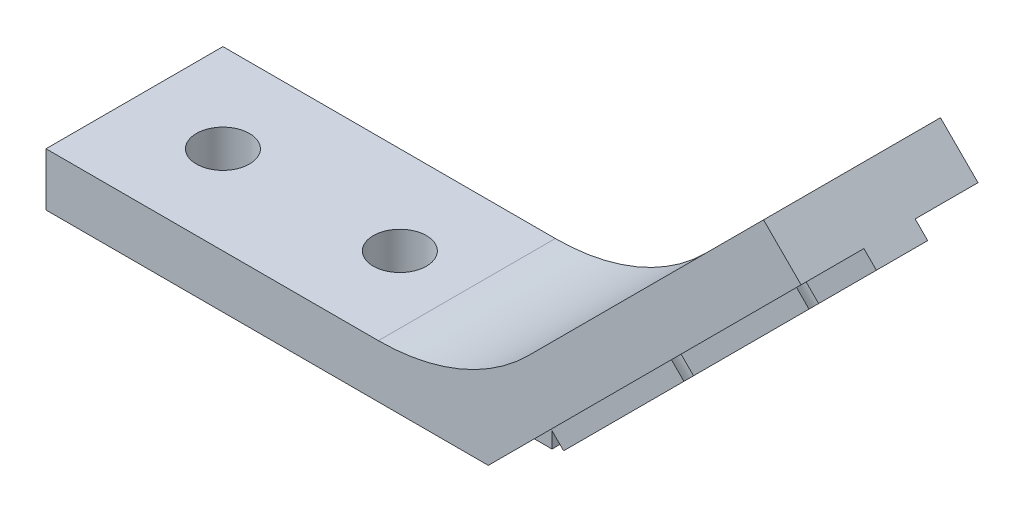
from build123d import *

# Parameters (mm, degrees)
BOSS_EXTRU_1_DEPTH           = 10
ESQUISSE4_W                  = 25
ESQUISSE4_H                  = 2.8
BOSS_EXTRU_2_DEPTH           = 1
ENL_V_MAT_EXTRU_1_DEPTH      = 34.421549934
ENL_V_MAT_EXTRU_1_DEPTH_BACK = 34.421549934
ESQUISSE2_R                  = 1.5
ESQUISSE5_W                  = 2.9
ESQUISSE5_H                  = 25
BOSS_EXTRU_3_DEPTH           = 1
ENL_V_MAT_EXTRU_2_DEPTH      = 34.421549934
ENL_V_MAT_EXTRU_2_DEPTH_BACK = 34.421549934
ESQUISSE3_R                  = 1.5


with BuildPart() as part:
    # Esquisse1 → Boss.-Extru.1 (new body)
    with BuildSketch(Plane.XY):
        with BuildLine():
            Line((-25, 0), (0, 0))
            Line((0, 0), (17.67766953, 17.67766953))
            Line((17.67766953, 17.67766953), (15.556349186, 19.798989873))
            Line((15.556349186, 19.798989873), (2.272077939, 6.514718626))
            ThreePointArc((2.272077939, 6.514718626), (-1.621002247, 3.91344561), (-6.213203436, 3))
            Line((-6.213203436, 3), (-25, 3))
            Line((-25, 3), (-25, 0))
        make_face()
    extrude(amount=BOSS_EXTRU_1_DEPTH)

    # Esquisse4 → Boss.-Extru.2 (add)
    with BuildSketch(Plane(origin=(0, 0, 0), x_dir=(-1, 0, 0), z_dir=(0, -1, 0))):
        with Locations((12.5, -5)):
            Rectangle(ESQUISSE4_W, ESQUISSE4_H)
    extrude(amount=BOSS_EXTRU_2_DEPTH)

    # Esquisse2 → Enlèv. mat.-Extru.1 (cut, two sides: drawn at the far end of the back side and taken through both)
    with BuildSketch(Plane.XZ.offset(-ENL_V_MAT_EXTRU_1_DEPTH_BACK)):
        with Locations((-20, 5)):
            Circle(ESQUISSE2_R)
        with Locations((-10, 5)):
            Circle(ESQUISSE2_R)
    extrude(amount=ENL_V_MAT_EXTRU_1_DEPTH + ENL_V_MAT_EXTRU_1_DEPTH_BACK, mode=Mode.SUBTRACT)

    # Esquisse5 → Boss.-Extru.3 (add)
    with BuildSketch(Plane(origin=(0, 0, 0), x_dir=(0, 0, -1), z_dir=(0.7071067811865485, -0.7071067811865466, 0))):
        with Locations((-5, 12.5)):
            Rectangle(ESQUISSE5_W, ESQUISSE5_H)
    extrude(amount=BOSS_EXTRU_3_DEPTH)

    # Esquisse3 → Enlèv. mat.-Extru.2 (cut, two sides: drawn at the far end of the back side and taken through both)
    with BuildSketch(Plane(origin=(0, 0, 0), x_dir=(0, 0, -1), z_dir=(0.7071067811865485, -0.7071067811865466, 0)).offset(-ENL_V_MAT_EXTRU_2_DEPTH_BACK)):
        with Locations((-5, 10)):
            Circle(ESQUISSE3_R)
        with Locations((-5, 20)):
            Circle(ESQUISSE3_R)
    extrude(amount=ENL_V_MAT_EXTRU_2_DEPTH + ENL_V_MAT_EXTRU_2_DEPTH_BACK, mode=Mode.SUBTRACT)


solid = part.part
